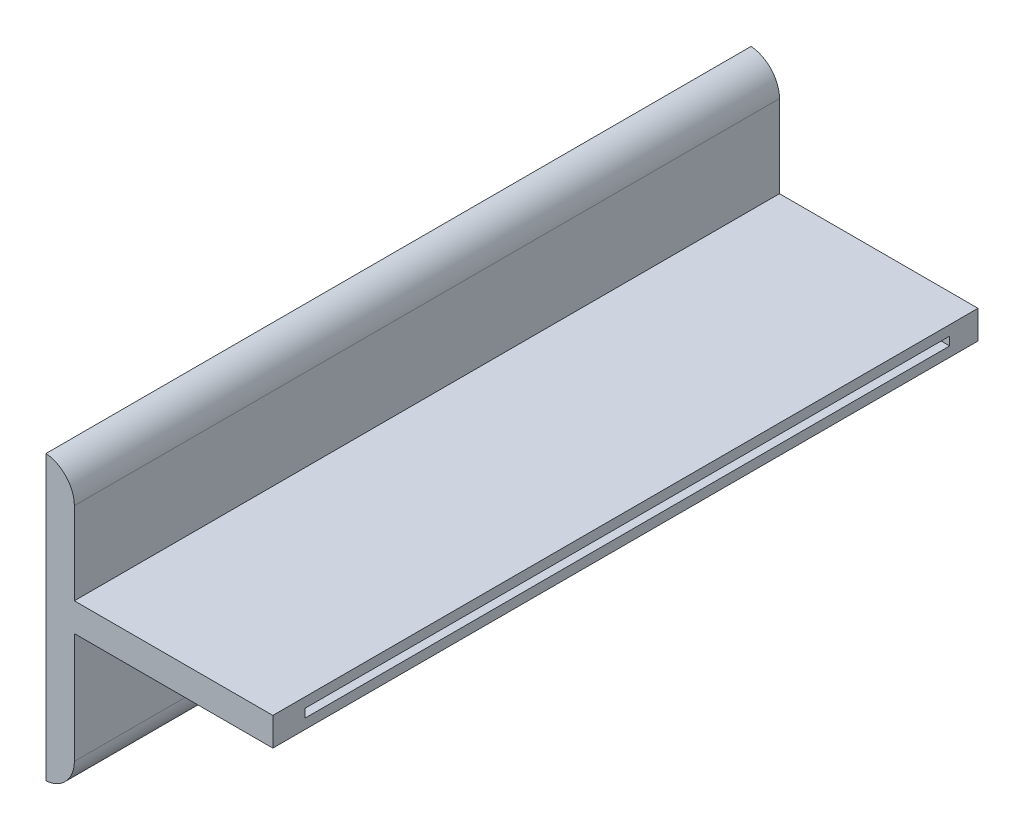
from build123d import *

# Parameters (mm, degrees)
SKETCH1_W           = 248.68
SKETCH1_H           = 10
BOSS_EXTRUDE1_DEPTH = 80
SKETCH3_W           = 10
SKETCH3_H           = 248.68
BOSS_EXTRUDE2_DEPTH = 40
SKETCH5_W           = 10
SKETCH5_H           = 248.68
BOSS_EXTRUDE3_DEPTH = 50
FILLET1_R           = 11
FILLET2_R           = 11
SKETCH6_W           = 227.416539417
SKETCH6_H           = 3
CUT_EXTRUDE2_DEPTH  = 70


with BuildPart() as part:
    # Sketch1 → Boss-Extrude1 (new body)
    with BuildSketch(Plane(origin=(0, 0, 0), x_dir=(0, 0, -1), z_dir=(1, 0, 0))):
        with Locations((117.31979798, -0.946969697)):
            Rectangle(SKETCH1_W, SKETCH1_H)
    extrude(amount=BOSS_EXTRUDE1_DEPTH)

    # Sketch3 → Boss-Extrude2 (add)
    with BuildSketch(Plane(origin=(0, 4.053030303, 0), x_dir=(1, 0, 0), z_dir=(0, 1, 0))):
        with Locations((5, 117.31979798)):
            Rectangle(SKETCH3_W, SKETCH3_H)
    extrude(amount=BOSS_EXTRUDE2_DEPTH)

    # Sketch5 → Boss-Extrude3 (add)
    with BuildSketch(Plane.XZ.offset(5.946969697)):
        with Locations((5, -117.31979798)):
            Rectangle(SKETCH5_W, SKETCH5_H)
    extrude(amount=BOSS_EXTRUDE3_DEPTH)

    # Fillet1
    # the kernel refuses this fillet: 11 mm, written as the material it takes off along each edge
    with BuildSketch(Plane(origin=(10, 44.053030303, -269.045925855), x_dir=(-1, 0, 0), z_dir=(0, 0, 1))) as fillet1_piece_1:
        with BuildLine():
            CenterArc((11, 10.95445115), FILLET1_R, 180, 84.78409143)
            Line((0, 10.95445115), (-0.22, 10.95445115))
            Line((-0.22, 10.95445115), (-0.22, 0))
            Line((-0.22, 0), (0, -0.22))
            ThreePointArc((0, -0.22), (5, -0.22), (9.98, -0.219089023))
            Line((9.98, -0.219089023), (10, 0))
        make_face()
    extrude(amount=303.452255751, mode=Mode.SUBTRACT)

    # Fillet2
    # the kernel refuses this fillet: 11 mm, written as the material it takes off along each edge
    with BuildSketch(Plane(origin=(10, -55.946969697, 34.406329895), x_dir=(-1, 0, 0), z_dir=(0, 0, -1))) as fillet2_piece_1:
        with BuildLine():
            CenterArc((11, 10.95445115), FILLET2_R, 180, 84.78409143)
            Line((0, 10.95445115), (-0.22, 10.95445115))
            Line((-0.22, 10.95445115), (-0.22, 0))
            Line((-0.22, 0), (0, -0.22))
            ThreePointArc((0, -0.22), (5, -0.22), (9.98, -0.219089023))
            Line((9.98, -0.219089023), (10, 0))
        make_face()
    extrude(amount=303.452255751, mode=Mode.SUBTRACT)

    # Sketch6 → Cut-Extrude2 (cut)
    with BuildSketch(Plane(origin=(80, 0, 0), x_dir=(0, 0, -1), z_dir=(1, 0, 0))):
        with Locations((117.951528272, -0.946969697)):
            Rectangle(SKETCH6_W, SKETCH6_H)
    extrude(amount=-CUT_EXTRUDE2_DEPTH, mode=Mode.SUBTRACT)


solid = part.part
